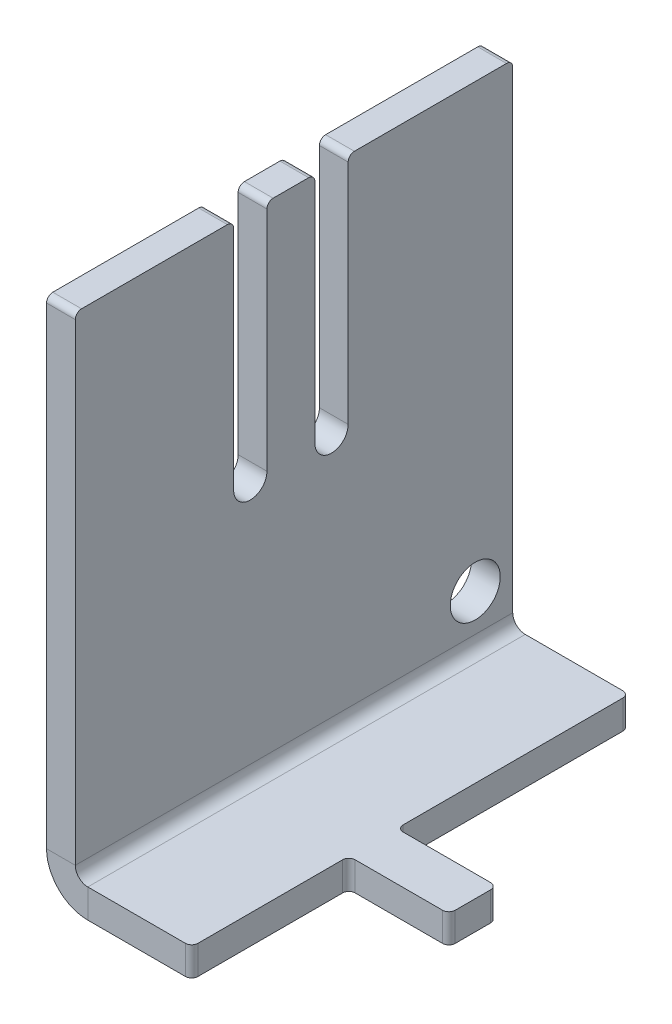
from build123d import *

# Parameters (mm, degrees)
BASE_FLANGE1_DEPTH       = 2.3
SKETCHED_BEND1_OUTLINE_W = 2.3
SKETCHED_BEND1_OUTLINE_H = 35
SKETCHED_BEND1_DEPTH     = 38.388606051
SKETCHED_START           = 38.709564051
SKETCHED_BEND1_2_DEPTH   = 1.979042
SKETCHED_START_2         = 38.388606051
SKETCHED_BEND1_3_DEPTH   = 3.3
SKETCHED_START_3         = -17.5
SKETCHED_BEND1_4_DEPTH   = 35
SKETCH7_R                = 2
CUT_EXTRUDE1_DEPTH       = 10


with BuildPart() as part:
    # Base-Flange1: sheet metal written as solids
    # Sketch1 → Base-Flange1 (new body)
    with BuildSketch(Plane(origin=(0, 0, 0), x_dir=(1, 0, 0), z_dir=(0, 1, 0))):
        with BuildLine():
            Line((0, 17), (0, 4.83))
            ThreePointArc((0, 4.83), (0.146446609, 4.476446609), (0.5, 4.33))
            Line((0.5, 4.33), (18.67, 4.33))
            ThreePointArc((18.67, 4.33), (20, 3), (18.67, 1.67))
            Line((18.67, 1.67), (0.5, 1.67))
            ThreePointArc((0.5, 1.67), (0.146446609, 1.523553391), (0, 1.17))
            Line((0, 1.17), (0, -1.67))
            ThreePointArc((0, -1.67), (0.146446609, -2.023553391), (0.5, -2.17))
            Line((0.5, -2.17), (18.67, -2.17))
            ThreePointArc((18.67, -2.17), (20, -3.5), (18.67, -4.83))
            Line((18.67, -4.83), (0.5, -4.83))
            ThreePointArc((0.5, -4.83), (0.146446609, -4.976446609), (0, -5.33))
            Line((0, -5.33), (0, -17))
            ThreePointArc((0, -17), (0.146446609, -17.353553391), (0.5, -17.5))
            Line((0.5, -17.5), (49.5, -17.5))
            ThreePointArc((49.5, -17.5), (49.853553391, -17.353553391), (50, -17))
            Line((50, -17), (50, -5.42))
            ThreePointArc((50, -5.42), (50.146446609, -5.066446609), (50.5, -4.92))
            Line((50.5, -4.92), (57.5, -4.92))
            ThreePointArc((57.5, -4.92), (57.853553391, -4.773553391), (58, -4.42))
            Line((58, -4.42), (58, -1.58))
            ThreePointArc((58, -1.58), (57.853553391, -1.226446609), (57.5, -1.08))
            Line((57.5, -1.08), (50.5, -1.08))
            ThreePointArc((50.5, -1.08), (50.146446609, -0.933553391), (50, -0.58))
            Line((50, -0.58), (50, 17))
            ThreePointArc((50, 17), (49.853553391, 17.353553391), (49.5, 17.5))
            Line((49.5, 17.5), (0.5, 17.5))
            ThreePointArc((0.5, 17.5), (0.146446609, 17.353553391), (0, 17))
        make_face()
    extrude(amount=-BASE_FLANGE1_DEPTH)

    # Sketched Bend1: read off the stored shape, not the designer's step
    # Sketched Bend1 outline → Sketched Bend1 (cut)
    with BuildSketch(Plane.YZ):
        with Locations((-1.15, 0)):
            Rectangle(SKETCHED_BEND1_OUTLINE_W, SKETCHED_BEND1_OUTLINE_H)
    extrude(amount=SKETCHED_BEND1_DEPTH, mode=Mode.SUBTRACT)

    # Sketched Bend1 2 outline → Sketched Bend1 2 (add)
    with BuildSketch(Plane.YZ.offset(SKETCHED_START)):
        with BuildLine():
            Line((0, -17.5), (38.811393949, -17.5))
            ThreePointArc((38.811393949, -17.5), (39.164947339, -17.353553391), (39.311393949, -17))
            Line((39.311393949, -17), (39.311393949, -4.83))
            ThreePointArc((39.311393949, -4.83), (39.16494734, -4.476446609), (38.811393949, -4.33))
            Line((38.811393949, -4.33), (20.641393949, -4.33))
            ThreePointArc((20.641393949, -4.33), (19.311393949, -3), (20.641393949, -1.67))
            Line((20.641393949, -1.67), (38.811393949, -1.67))
            ThreePointArc((38.811393949, -1.67), (39.16494734, -1.523553391), (39.311393949, -1.17))
            Line((39.311393949, -1.17), (39.311393949, 1.67))
            ThreePointArc((39.311393949, 1.67), (39.16494734, 2.023553391), (38.811393949, 2.17))
            Line((38.811393949, 2.17), (20.641393949, 2.17))
            ThreePointArc((20.641393949, 2.17), (19.311393949, 3.5), (20.641393949, 4.83))
            Line((20.641393949, 4.83), (38.811393949, 4.83))
            ThreePointArc((38.811393949, 4.83), (39.16494734, 4.976446609), (39.311393949, 5.33))
            Line((39.311393949, 5.33), (39.311393949, 17))
            ThreePointArc((39.311393949, 17), (39.164947339, 17.353553391), (38.811393949, 17.5))
            Line((38.811393949, 17.5), (0, 17.5))
            Line((0, 17.5), (0, -17.5))
        make_face()
    extrude(amount=SKETCHED_BEND1_2_DEPTH)

    # Sketched Bend1 3 outline → Sketched Bend1 3 (add)
    with BuildSketch(Plane.YZ.offset(SKETCHED_START_2)):
        with BuildLine():
            Line((0, -17.5), (38.811393949, -17.5))
            ThreePointArc((38.811393949, -17.5), (39.164947339, -17.353553391), (39.311393949, -17))
            Line((39.311393949, -17), (39.311393949, -4.83))
            ThreePointArc((39.311393949, -4.83), (39.16494734, -4.476446609), (38.811393949, -4.33))
            Line((38.811393949, -4.33), (20.641393949, -4.33))
            ThreePointArc((20.641393949, -4.33), (19.311393949, -3), (20.641393949, -1.67))
            Line((20.641393949, -1.67), (38.811393949, -1.67))
            ThreePointArc((38.811393949, -1.67), (39.16494734, -1.523553391), (39.311393949, -1.17))
            Line((39.311393949, -1.17), (39.311393949, 1.67))
            ThreePointArc((39.311393949, 1.67), (39.16494734, 2.023553391), (38.811393949, 2.17))
            Line((38.811393949, 2.17), (20.641393949, 2.17))
            ThreePointArc((20.641393949, 2.17), (19.311393949, 3.5), (20.641393949, 4.83))
            Line((20.641393949, 4.83), (38.811393949, 4.83))
            ThreePointArc((38.811393949, 4.83), (39.16494734, 4.976446609), (39.311393949, 5.33))
            Line((39.311393949, 5.33), (39.311393949, 17))
            ThreePointArc((39.311393949, 17), (39.164947339, 17.353553391), (38.811393949, 17.5))
            Line((38.811393949, 17.5), (0, 17.5))
            Line((0, 17.5), (0, -17.5))
        make_face()
    extrude(amount=SKETCHED_BEND1_3_DEPTH)

    # Sketched Bend1 4 outline → Sketched Bend1 4 (cut)
    with BuildSketch(Plane.XY.offset(SKETCHED_START_3)):
        with BuildLine():
            Line((41.688606051, 39.311393949), (40.688606051, 39.311393949))
            Line((40.688606051, 39.311393949), (40.688606051, 1))
            ThreePointArc((40.688606051, 1), (40.98149927, 0.292893219), (41.688606051, 0))
            Line((41.688606051, 0), (41.688606051, 39.311393949))
        make_face()
        with BuildLine():
            ThreePointArc((41.688606051, -2.3), (39.355153673, -1.333452378), (38.388606051, 1))
            Line((38.388606051, 1), (38.388606051, -2.3))
            Line((38.388606051, -2.3), (41.688606051, -2.3))
        make_face()
    extrude(amount=SKETCHED_BEND1_4_DEPTH, mode=Mode.SUBTRACT)

    # Sketch7 → Cut-Extrude1 (cut)
    with BuildSketch(Plane.ZY.offset(-38.388606051)):
        with Locations(Location((-14.5, 4, 0), (0, 0, 270))):
            Circle(SKETCH7_R)
    extrude(amount=-CUT_EXTRUDE1_DEPTH, mode=Mode.SUBTRACT)


solid = part.part
